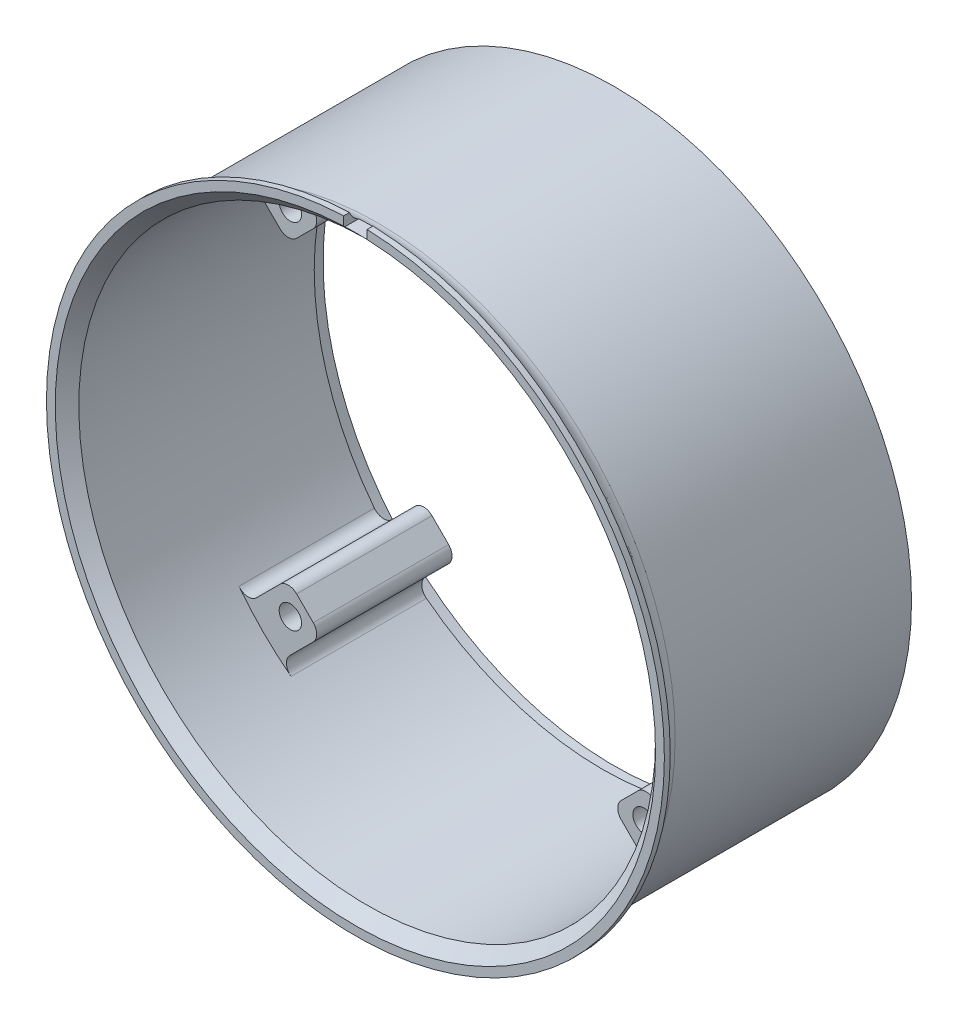
from build123d import *

# Parameters (mm, degrees)
SKETCH2_R                = 50.5
BOSS_EXTRUDE2_DEPTH      = 2
SKETCH3_R                = 50.5
SKETCH3_R_2              = 49
BOSS_EXTRUDE3_DEPTH      = 42
BOSS_EXTRUDE4_START      = -1
SKETCH4_R                = 52.5
SKETCH4_R_2              = 49
BOSS_EXTRUDE4_DEPTH      = 1
FILLET1_R                = 3
CHAMFER1_SIZE            = 2
SKETCH5_R                = 3
SKETCH5_R_2              = 2
SKETCH5_R_3              = 3.125
SKETCH5_R_4              = 3.625
CUT_EXTRUDE3_DEPTH       = 87.304692804
CIRPATTERN1_COUNT        = 4
BOSS_EXTRUDE6_DEPTH      = 25
FILLET3_R                = 2
CIRPATTERN2_COUNT        = 4
FILLET3_OF_CIRPATTERN2_R = 2
CUT_EXTRUDE4_DEPTH       = 87.304692804
SKETCH12_R               = 49.5
CUT_EXTRUDE5_DEPTH       = 2
CUT_EXTRUDE6_REACH       = 88.305
SKETCH10_R               = 1.9
CIRPATTERN3_COUNT        = 4


with BuildPart() as part:
    # Sketch2 → Boss-Extrude2 (new body)
    with BuildSketch(Plane.XY):
        Circle(SKETCH2_R)
    extrude(amount=BOSS_EXTRUDE2_DEPTH)

    # Sketch3 → Boss-Extrude3 (add)
    with BuildSketch(Plane.XY.offset(2)):
        Circle(SKETCH3_R)
        with Locations(Location((0, 0, 0), (0, 0, 180))):
            Circle(SKETCH3_R_2, mode=Mode.SUBTRACT)
    extrude(amount=BOSS_EXTRUDE3_DEPTH)

    # Sketch4 → Boss-Extrude4 (add)
    with BuildSketch(Plane.XY.offset(44).offset(BOSS_EXTRUDE4_START)):
        Circle(SKETCH4_R)
        with Locations(Location((0, 0, 0), (0, 0, 180))):
            Circle(SKETCH4_R_2, mode=Mode.SUBTRACT)
    extrude(amount=BOSS_EXTRUDE4_DEPTH)

    # Fillet1
    # the kernel refuses this fillet: 3 mm, written as the material it adds along each edge
    with BuildSketch(Plane(origin=(0, 0, 43), x_dir=(1, 0, 0), z_dir=(0, 1, 0))) as fillet1_piece_1:
        with BuildLine():
            CenterArc((53.5, 2.828427125), FILLET1_R, 180, 70.528779366)
            Line((52.5, 0), (52.48, -0.056568542))
            ThreePointArc((52.48, -0.056568542), (51.5, -0.06), (50.5, -0.06))
            Line((50.5, -0.06), (50.44, 0))
            Line((50.44, 0), (50.44, 2.828427125))
            Line((50.44, 2.828427125), (50.5, 2.828427125))
        make_face()
    revolve(axis=Axis((0, 0, 43), (0, 0, -1)))

    # Chamfer1
    chamfer1_edges = [part.edges().sort_by_distance(p)[0] for p in [
        (49, 0, 44),
    ]]
    chamfer(chamfer1_edges, length=CHAMFER1_SIZE)

    # Sketch5 → Cut-Extrude3 (cut, through all)
    with BuildSketch(Plane.XY):
        with Locations((0, 20)):
            Circle(SKETCH5_R)
        with Locations((0, 10)):
            Circle(SKETCH5_R_2)
        with Locations((0, 30)):
            Circle(SKETCH5_R_2)
        with Locations((10.125, 20)):
            Circle(SKETCH5_R_3)
        with Locations((-10.125, 20)):
            Circle(SKETCH5_R_4)
    cut_extrude3 = extrude(amount=CUT_EXTRUDE3_DEPTH, mode=Mode.SUBTRACT)

    # CirPattern1: Cut-Extrude3 ×4 about axis
    cirpattern1_axis = Axis((0, 0, 0), (0, 0, 1))
    for i in range(1, CIRPATTERN1_COUNT):
        add(cut_extrude3.rotate(cirpattern1_axis, i * 360 / CIRPATTERN1_COUNT), mode=Mode.SUBTRACT)

    # Sketch7 → Boss-Extrude6 (add)
    with BuildSketch(Plane(origin=(0, 0, 0), x_dir=(-1, 0, 0), z_dir=(0, 0, -1))):
        with BuildLine():
            Line((31.704166175, 37.361020424), (24.748737342, 30.405591591))
            Line((24.748737342, 30.405591591), (30.405591591, 24.748737342))
            Line((30.405591591, 24.748737342), (37.361020424, 31.704166175))
            ThreePointArc((37.361020424, 31.704166175), (34.648232278, 34.648232278), (31.704166175, 37.361020424))
        make_face()
    boss_extrude6 = extrude(amount=-BOSS_EXTRUDE6_DEPTH)

    # Fillet3
    fillet3_edges = [part.edges().sort_by_distance(p)[0] for p in [
        (-30.405591591, 24.748737342, 13.5),
        (-24.748737342, 30.405591591, 13.5),
        (-31.704166175, 37.361020424, 13.5),
        (-37.361020424, 31.704166175, 13.5),
    ]]
    fillet(fillet3_edges, radius=FILLET3_R)

    # CirPattern2: Boss-Extrude6 ×4 about axis
    cirpattern2_axis = Axis((0, 0, 0), (0, 0, 1))
    for i in range(1, CIRPATTERN2_COUNT):
        add(boss_extrude6.rotate(cirpattern2_axis, i * 360 / CIRPATTERN2_COUNT))

    # Fillet3 of CirPattern2
    fillet3_of_cirpattern2_edges = [part.edges().sort_by_distance(p)[0] for p in [
        (-24.748737342, -30.405591591, 13.5),
        (-30.405591591, -24.748737342, 13.5),
        (-37.361020424, -31.704166175, 13.5),
        (-31.704166175, -37.361020424, 13.5),
        (30.405591591, -24.748737342, 13.5),
        (24.748737342, -30.405591591, 13.5),
        (31.704166175, -37.361020424, 13.5),
        (37.361020424, -31.704166175, 13.5),
        (24.748737342, 30.405591591, 13.5),
        (30.405591591, 24.748737342, 13.5),
        (37.361020424, 31.704166175, 13.5),
        (31.704166175, 37.361020424, 13.5),
    ]]
    fillet(fillet3_of_cirpattern2_edges, radius=FILLET3_OF_CIRPATTERN2_R)

    # Sketch9 → Cut-Extrude4 (cut, through all)
    with BuildSketch(Plane.XY):
        with BuildLine():
            Line((-2, 52.46189093), (-2, 50.75))
            Line((-2, 50.75), (2, 50.75))
            Line((2, 50.75), (2, 52.46189093))
            ThreePointArc((2, 52.46189093), (0, 52.5), (-2, 52.46189093))
        make_face()
    extrude(amount=CUT_EXTRUDE4_DEPTH, mode=Mode.SUBTRACT)

    # Sketch12 → Cut-Extrude5 (cut)
    with BuildSketch(Plane.XY):
        Circle(SKETCH12_R)
    extrude(amount=CUT_EXTRUDE5_DEPTH, mode=Mode.SUBTRACT)

    # Sketch10 → Cut-Extrude6 (cut, up to next)
    with BuildSketch(Plane.XY, mode=Mode.PRIVATE) as cut_extrude6_sk1:
        with Locations(Location((-30.0520382, 30.0520382, 0), (0, 0, 180))):
            Circle(SKETCH10_R)
    cut_extrude6_tool1 = extrude(cut_extrude6_sk1.sketch, amount=CUT_EXTRUDE6_REACH, mode=Mode.PRIVATE) & part.part
    cut_extrude6 = cut_extrude6_tool1.solids().sort_by_distance((-30.052038, 30.052038, 0))[0]
    add(cut_extrude6, mode=Mode.SUBTRACT)

    # CirPattern3: Cut-Extrude6 ×4 about axis
    cirpattern3_axis = Axis((0, 0, 0), (0, 0, 1))
    for i in range(1, CIRPATTERN3_COUNT):
        add(cut_extrude6.rotate(cirpattern3_axis, i * 360 / CIRPATTERN3_COUNT), mode=Mode.SUBTRACT)


solid = part.part
